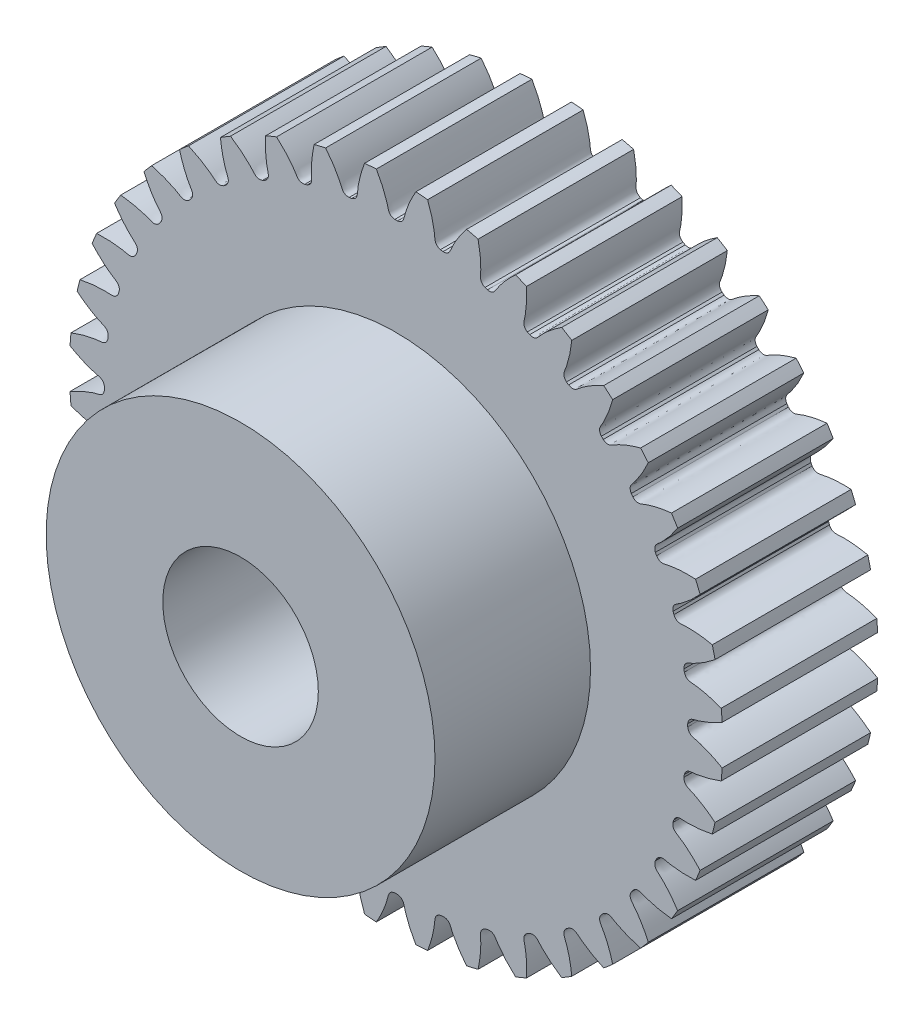
from build123d import *

# Parameters (mm, degrees)
SKETCH_1_R               = 21
EXTRUDE_1_DEPTH          = 10
CUT_EXTRUDE_1_DEPTH      = 32.336879232
PATTERN_CIRCULAR_1_COUNT = 40
SKETCH_4_R               = 12.5
EXTRUDE_2_DEPTH          = 10
SKETCH_5_R               = 5
CUT_EXTRUDE_2_DEPTH      = 28


with BuildPart() as part:
    # 草图1 → 凸台-拉伸1 (new body)
    with BuildSketch(Plane.XY):
        Circle(SKETCH_1_R)
    extrude(amount=EXTRUDE_1_DEPTH)

    # 草图2 → 切除-拉伸1 (cut, through all)
    with BuildSketch(Plane.XY):
        with BuildLine():
            ThreePointArc((0.08459088, 18.749809183), (0, 18.75), (-0.08459088, 18.749809183))
            add(Edge.make_bspline(
                [(-0.08459088, 18.749809183), (-0.455665039, 18.804049096), (-0.489490413, 19.070485476), (-0.566971685, 19.356193817), (-0.593922885, 19.449265442), (-0.625039566, 19.54891925), (-0.660501228, 19.655073344), (-0.700607327, 19.767575905), (-0.745616668, 19.886285254), (-0.795794923, 20.011046149), (-0.851400304, 20.141696924), (-0.912687493, 20.278067532), (-0.979906215, 20.419980264), (-1.053301386, 20.567249694), (-1.1331128, 20.719682853), (-1.219574956, 20.877079352), (-1.31291685, 21.039231513), (-1.413361781, 21.205924516), (-1.521127152, 21.37693654), (-1.636424288, 21.552038918), (-1.759458243, 21.730996291), (-1.890427621, 21.913566767), (-2.029524395, 22.099502086), (-2.176933736, 22.288547794), (-2.332833838, 22.480443408), (-2.497395757, 22.674922602), (-2.670783242, 22.871713389), (-2.853152597, 23.070538299), (-3.044652456, 23.271114581), (-3.315880545, 23.54405611), (-3.528188473, 23.745104465), (-3.674133343, 23.878013579)],
                knots=[0, 0, 0, 0, 0.110656833, 0.124738805, 0.140005423, 0.156456686, 0.174092594, 0.192913148, 0.212918347, 0.234108191, 0.25648268, 0.280041814, 0.304785594, 0.330714019, 0.357827089, 0.386124804, 0.415607165, 0.446274171, 0.478125822, 0.511162118, 0.545383059, 0.580788646, 0.617378878, 0.655153755, 0.694113277, 0.734257445, 0.775586258, 0.818099716, 0.861797819, 0.906680567, 1, 1, 1, 1], degree=3))
            ThreePointArc((-3.674133343, 23.878013579), (0, 24.159031195), (3.674133343, 23.878013579))
            add(Edge.make_bspline(
                [(0.08459088, 18.749809183), (0.455665039, 18.804049096), (0.489490413, 19.070485476), (0.566971685, 19.356193817), (0.593922885, 19.449265442), (0.625039566, 19.54891925), (0.660501228, 19.655073344), (0.700607327, 19.767575905), (0.745616668, 19.886285254), (0.795794923, 20.011046149), (0.851400304, 20.141696924), (0.912687493, 20.278067532), (0.979906215, 20.419980264), (1.053301386, 20.567249694), (1.1331128, 20.719682853), (1.219574956, 20.877079352), (1.31291685, 21.039231513), (1.413361781, 21.205924516), (1.521127152, 21.37693654), (1.636424288, 21.552038918), (1.759458243, 21.730996291), (1.890427621, 21.913566767), (2.029524395, 22.099502086), (2.176933736, 22.288547794), (2.332833838, 22.480443408), (2.497395757, 22.674922602), (2.670783242, 22.871713389), (2.853152597, 23.070538299), (3.044652456, 23.271114581), (3.315880545, 23.54405611), (3.528188473, 23.745104465), (3.674133343, 23.878013579)],
                knots=[0, 0, 0, 0, 0.110656833, 0.124738805, 0.140005423, 0.156456686, 0.174092594, 0.192913148, 0.212918347, 0.234108191, 0.25648268, 0.280041814, 0.304785594, 0.330714019, 0.357827089, 0.386124804, 0.415607165, 0.446274171, 0.478125822, 0.511162118, 0.545383059, 0.580788646, 0.617378878, 0.655153755, 0.694113277, 0.734257445, 0.775586258, 0.818099716, 0.861797819, 0.906680567, 1, 1, 1, 1], degree=3))
        make_face()
    cut_extrude_1 = extrude(amount=CUT_EXTRUDE_1_DEPTH, mode=Mode.SUBTRACT)

    # 阵列(圆周)1: 切除-拉伸1 ×40 about axis
    pattern_circular_1_axis = Axis((0, 0, -1.5), (0, 0, 1))
    for i in range(1, PATTERN_CIRCULAR_1_COUNT):
        add(cut_extrude_1.rotate(pattern_circular_1_axis, i * 360 / PATTERN_CIRCULAR_1_COUNT), mode=Mode.SUBTRACT)

    # 草图4 → 凸台-拉伸2 (add)
    with BuildSketch(Plane.XY.offset(10)):
        Circle(SKETCH_4_R)
    extrude(amount=EXTRUDE_2_DEPTH)

    # 草图5 → 切除-拉伸2 (cut)
    with BuildSketch(Plane.XY.offset(20)):
        Circle(SKETCH_5_R)
    extrude(amount=-CUT_EXTRUDE_2_DEPTH, mode=Mode.SUBTRACT)


solid = part.part
